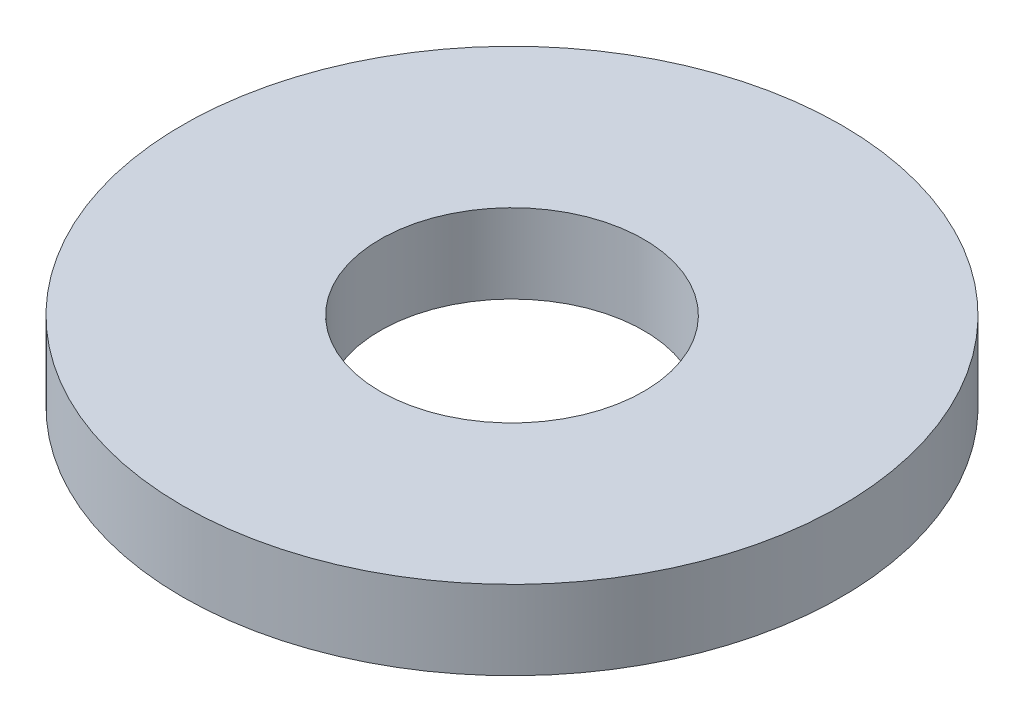
from build123d import *

# Parameters (mm, degrees)
SKETCH1_R           = 62.5
BOSS_EXTRUDE1_DEPTH = 15
SKETCH2_R           = 25
CUT_EXTRUDE1_DEPTH  = 90.652105385


with BuildPart() as part:
    # Sketch1 → Boss-Extrude1 (new body)
    with BuildSketch(Plane(origin=(0, 0, 0), x_dir=(1, 0, 0), z_dir=(0, 1, 0))):
        Circle(SKETCH1_R)
    extrude(amount=BOSS_EXTRUDE1_DEPTH)

    # Sketch2 → Cut-Extrude1 (cut, through all)
    with BuildSketch(Plane(origin=(0, 0, 0), x_dir=(1, 0, 0), z_dir=(0, 1, 0))):
        Circle(SKETCH2_R)
    extrude(amount=CUT_EXTRUDE1_DEPTH, mode=Mode.SUBTRACT)


solid = part.part
